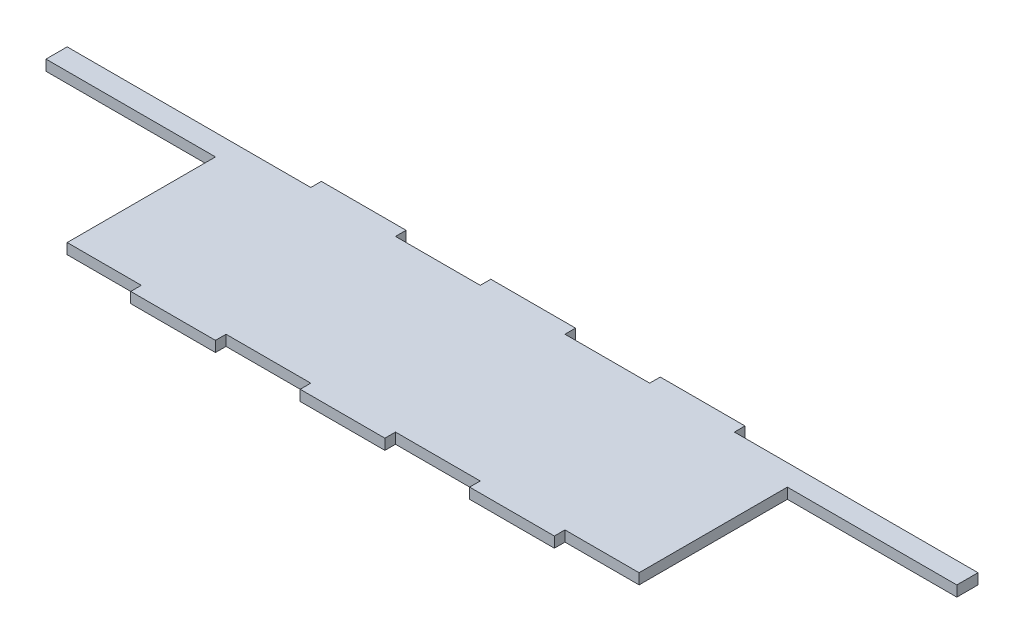
from build123d import *

# Parameters (mm, degrees)
BOSS_EXTRUDE1_DEPTH = 3.175


with BuildPart() as part:
    # Sketch1 → Boss-Extrude1 (new body)
    with BuildSketch(Plane(origin=(0, 0, 0), x_dir=(1, 0, 0), z_dir=(0, 1, 0))):
        Polygon((-136.525, 25.4), (-136.525, 19.05), (-85.725, 19.05), (-85.725, -25.4), (-63.5, -25.4), (-63.5, -28.575), (-38.1, -28.575), (-38.1, -25.4), (-12.7, -25.4), (-12.7, -28.575), (12.7, -28.575), (12.7, -25.4), (38.1, -25.4), (38.1, -28.575), (63.5, -28.575), (63.5, -25.4), (85.725, -25.4), (85.725, 19.05), (136.525, 19.05), (136.525, 25.4), (63.5, 25.4), (63.5, 28.575), (38.1, 28.575), (38.1, 25.4), (12.7, 25.4), (12.7, 28.575), (-12.7, 28.575), (-12.7, 25.4), (-38.1, 25.4), (-38.1, 28.575), (-63.5, 28.575), (-63.5, 25.4), align=None)
    extrude(amount=BOSS_EXTRUDE1_DEPTH)


solid = part.part
